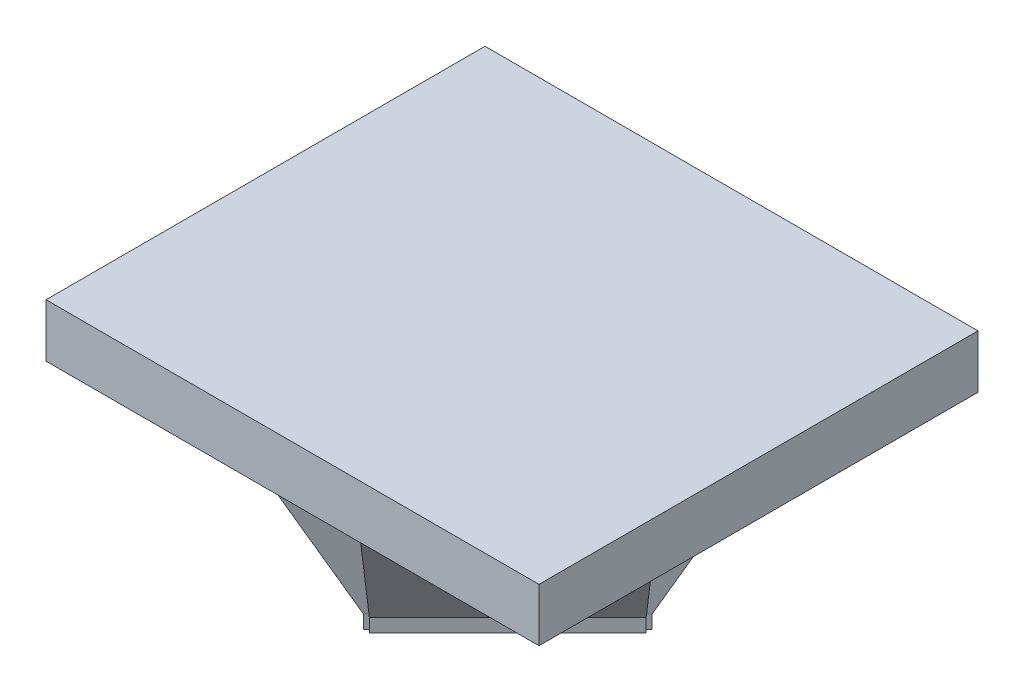
from build123d import *

# Parameters (mm, degrees)
SKETCH1_W           = 93.2
SKETCH1_H           = 83
BOSS_EXTRUDE1_DEPTH = 10.05
BOSS_EXTRUDE3_DEPTH = 2.5


with BuildPart() as part:
    # Sketch1 → Boss-Extrude1 (new body)
    with BuildSketch(Plane(origin=(0, 0, 0), x_dir=(1, 0, 0), z_dir=(0, 1, 0))):
        Rectangle(SKETCH1_W, SKETCH1_H)
    extrude(amount=-BOSS_EXTRUDE1_DEPTH)

    # Sketch3 → Loft3 section 0
    with BuildSketch(Plane(origin=(0, -36.25, 0), x_dir=(-1, 0, 0), z_dir=(0, -1, 0))):
        with BuildLine():
            Line((0.25082265, 26.712128254), (-25.912128254, 0.54917735))
            Line((-25.912128254, 0.54917735), (-25.362950904, 0))
            Line((-25.362950904, 0), (-25.912128254, -0.54917735))
            Line((-25.912128254, -0.54917735), (0.25082265, -26.712128254))
            Line((0.25082265, -26.712128254), (0.8, -26.162950904))
            Line((0.8, -26.162950904), (1.34917735, -26.712128254))
            Line((1.34917735, -26.712128254), (27.512128254, -0.54917735))
            Line((27.512128254, -0.54917735), (26.962950904, 0))
            Line((26.962950904, 0), (27.512128254, 0.54917735))
            Line((27.512128254, 0.54917735), (1.34917735, 26.712128254))
            Line((1.34917735, 26.712128254), (0.8, 26.162950904))
            Line((0.8, 26.162950904), (0.25082265, 26.712128254))
        make_face()
    # Sketch2 → Loft3 section 1
    with BuildSketch(Plane.XZ.offset(10.05)):
        with BuildLine():
            Line((-10.718342201, -38.202613448), (-0.8, -28.284271247))
            Line((-0.8, -28.284271247), (9.118342201, -38.202613448))
            Line((9.118342201, -38.202613448), (37.402613448, -9.918342201))
            Line((37.402613448, -9.918342201), (27.484271247, 0))
            Line((27.484271247, 0), (37.402613448, 9.918342201))
            Line((37.402613448, 9.918342201), (9.118342201, 38.202613448))
            Line((9.118342201, 38.202613448), (-0.8, 28.284271247))
            Line((-0.8, 28.284271247), (-10.718342201, 38.202613448))
            Line((-10.718342201, 38.202613448), (-39.002613448, 9.918342201))
            Line((-39.002613448, 9.918342201), (-29.084271247, 0))
            Line((-29.084271247, 0), (-39.002613448, -9.918342201))
            Line((-39.002613448, -9.918342201), (-10.718342201, -38.202613448))
        make_face()
    loft()

    # Sketch5 → Boss-Extrude3 (add)
    with BuildSketch(Plane.XZ.offset(36.25)):
        Polygon((-0.8, -26.162950904), (-0.25082265, -26.712128254), (25.912128254, -0.54917735), (25.362950904, 0), (25.912128254, 0.54917735), (-0.25082265, 26.712128254), (-0.8, 26.162950904), (-1.34917735, 26.712128254), (-27.512128254, 0.54917735), (-26.962950904, 0), (-27.512128254, -0.54917735), (-1.34917735, -26.712128254), align=None)
    extrude(amount=BOSS_EXTRUDE3_DEPTH)


solid = part.part
